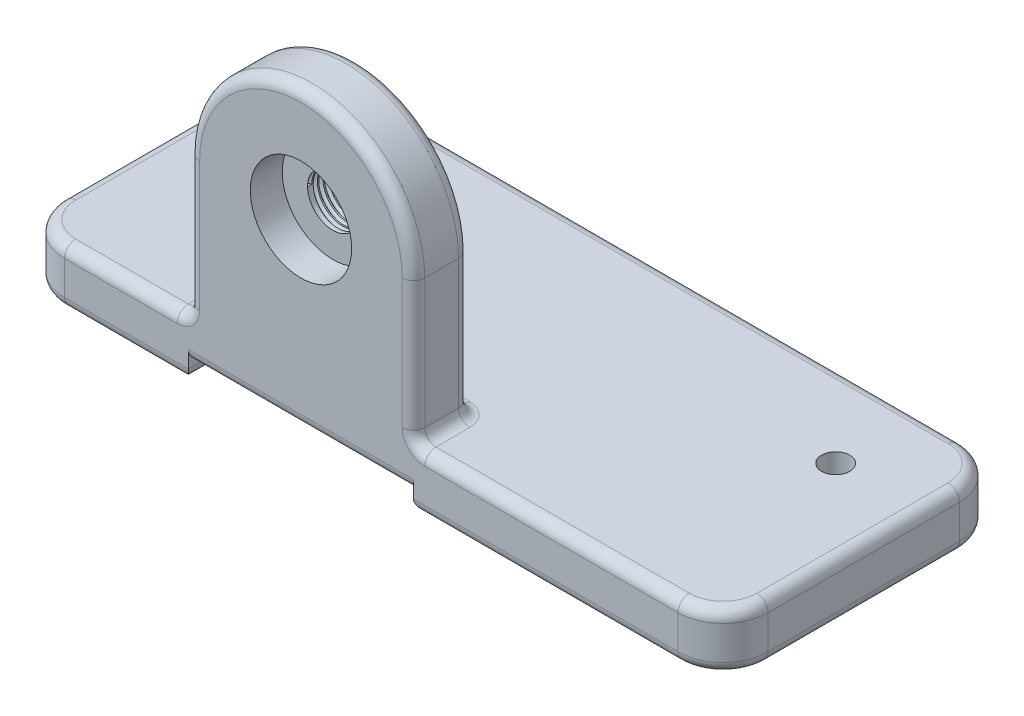
from build123d import *

# Parameters (mm, degrees)
SKETCH2_W                               = 125
SKETCH2_H                               = 50
BOSS_EXTRUDE1_DEPTH                     = 10
BOSS_EXTRUDE2_DEPTH                     = 10
SKETCH5_W                               = 40
SKETCH5_H                               = 3
CUT_EXTRUDE1_DEPTH                      = 146.430395722
CBORE_FOR_M8_HEX_HEAD_BOLT1_D           = 9
CBORE_FOR_M8_HEX_HEAD_BOLT1_CBORE_D     = 18.01
CBORE_FOR_M8_HEX_HEAD_BOLT1_CBORE_DEPTH = 5.68
THREAD1_PITCH                           = 1
F_5_0MM_DOWEL_HOLE2_D                   = 5
F_5_0MM_DOWEL_HOLE2_DEPTH               = 5
F_5_0MM_DOWEL_HOLE2_TIP                 = 1.502151548
FILLET2_R                               = 2
FILLET3_R                               = 8


with BuildPart() as part:
    # Sketch2 → Boss-Extrude1 (new body)
    with BuildSketch(Plane(origin=(0, 0, 0), x_dir=(1, 0, 0), z_dir=(0, 1, 0))):
        with Locations((62.5, 25)):
            Rectangle(SKETCH2_W, SKETCH2_H)
    extrude(amount=BOSS_EXTRUDE1_DEPTH)

    # Sketch4 → Boss-Extrude2 (add)
    with BuildSketch(Plane.XY):
        with BuildLine():
            Line((30, 0), (30, 35))
            ThreePointArc((30, 35), (50, 55), (70, 35))
            Line((70, 35), (70, 0))
            Line((70, 0), (30, 0))
        make_face()
    extrude(amount=-BOSS_EXTRUDE2_DEPTH)

    # Sketch5 → Cut-Extrude1 (cut, through all)
    with BuildSketch(Plane.XY):
        with Locations((50, 1.5)):
            Rectangle(SKETCH5_W, SKETCH5_H)
    extrude(amount=-CUT_EXTRUDE1_DEPTH, mode=Mode.SUBTRACT)

    # CBORE for M8 Hex Head Bolt1 (through all)
    with Locations(Plane.XY):
        with Locations((50, 35)):
            CounterBoreHole(CBORE_FOR_M8_HEX_HEAD_BOLT1_D / 2, CBORE_FOR_M8_HEX_HEAD_BOLT1_CBORE_D / 2, CBORE_FOR_M8_HEX_HEAD_BOLT1_CBORE_DEPTH)

    # Thread1: the profile of Thread Profile2 profile screwed along a right-hand helix of 10 turns, 8 arcs to a turn; built about Z, then put on its axis
    thread1_z = Axis((0, 0, 0), (0, 0, 1))
    thread1_corners = [(4.4997, 0, -0.000173205), (5.041265875, 0, 0.312499999), (5.041265875, 0, 0.437499999), (4.4997, 0, 0.750173202)]
    with BuildLine(mode=Mode.PRIVATE) as thread1_profile:
        Line(thread1_corners[0], thread1_corners[1])
        Line(thread1_corners[1], thread1_corners[2])
        Line(thread1_corners[2], thread1_corners[3])
        Line(thread1_corners[3], thread1_corners[0])
    thread1_cap = Face(thread1_profile.wire())
    thread1_turn_angles = [0, 22.5, 45, 67.5, 90, 112.5, 135, 157.5, 180, 202.5, 225, 247.5, 270, 292.5, 315, 337.5, 360]
    thread1_turn_weights = [1, 0.9238795325112867, 1, 0.9238795325112867, 1, 0.9238795325112867, 1, 0.9238795325112867, 1, 0.9238795325112867, 1, 0.9238795325112867, 1, 0.9238795325112867, 1, 0.9238795325112867, 1]
    thread1_turn_rails = [Edge.make_bspline([Vector(p[0], p[1], 0).rotate(thread1_z, thread1_turn_angles[k]) / thread1_turn_weights[k] + Vector(0, 0, p[2] + THREAD1_PITCH * thread1_turn_angles[k] / 360) for k in range(17)], [0, 0, 0, 1, 1, 2, 2, 3, 3, 4, 4, 5, 5, 6, 6, 7, 7, 8, 8, 8], 2, thread1_turn_weights) for p in thread1_corners]
    thread1_turn_sides = [Face.make_surface_from_curves(thread1_turn_rails[p[0]], thread1_turn_rails[p[1]]) for p in [(0, 1), (1, 2), (2, 3), (3, 0)]]
    thread1 = Plane(origin=(50, 35, -5.68), x_dir=(-1, 0, 0), z_dir=(0, 0, -1)) * Solid(Shell([*[p.moved(Location((0, 0, THREAD1_PITCH * i))) for i in range(10) for p in thread1_turn_sides], thread1_cap, thread1_cap.rotate(thread1_z, 3600).moved(Location((0, 0, THREAD1_PITCH * 3600 / 360)))]))
    add(thread1, mode=Mode.SUBTRACT)

    # Ø5.0mm Dowel Hole2
    with Locations(Plane(origin=(0, 10, 0), x_dir=(1, 0, 0), z_dir=(0, 1, 0))):
        with Locations((15, 35), (110, 35)):
            Hole(F_5_0MM_DOWEL_HOLE2_D / 2, depth=F_5_0MM_DOWEL_HOLE2_DEPTH)
            with Locations((0, 0, -(F_5_0MM_DOWEL_HOLE2_DEPTH + F_5_0MM_DOWEL_HOLE2_TIP / 2))):  # 118° drill point
                Cone(0, F_5_0MM_DOWEL_HOLE2_D / 2, F_5_0MM_DOWEL_HOLE2_TIP, mode=Mode.SUBTRACT)

    # Fillet2
    fillet2_edges = [part.edges().sort_by_distance(p)[0] for p in [
        (125, 10, -25),
        (97.5, 10, 0),
        (62.5, 10, -50),
        (30, 10, -5),
        (70, 10, -5),
        (30, 22.5, -10),
        (50, 55, -10),
        (70, 22.5, -10),
        (50, 55, 0),
        (50, 10, -10),
        (97.5, 0, 0),
        (15, 0, -50),
        (30, 0, -25),
        (50, 3, -50),
        (70, 0, -25),
        (50, 3, 0),
        (0, 10, -25),
        (97.5, 0, -50),
        (125, 0, -25),
        (15, 0, 0),
        (0, 0, -25),
        (15, 10, 0),
    ]]
    fillet(fillet2_edges, radius=FILLET2_R)

    # Fillet3
    # the kernel refuses this fillet: 8 mm, written as the material it takes off along each edge
    with BuildSketch(Plane(origin=(8, 10, -42), x_dir=(0, 0, -1), z_dir=(1, 0, 0))) as fillet3_piece_1:
        with BuildLine():
            CenterArc((6, -2), 2, 0, 90)
            Line((8, -2), (8, 0))
            Line((8, 0), (6, 0))
        make_face()
    revolve(axis=Axis((8, 10, -42), (0, 1, 0)), revolution_arc=90, mode=Mode.SUBTRACT)
    with BuildSketch(Plane(origin=(117, 10, -42), x_dir=(1, 0, 0), z_dir=(0, 0, 1))) as fillet3_piece_2:
        with BuildLine():
            CenterArc((6, -2), 2, 0, 90)
            Line((8, -2), (8, 0))
            Line((8, 0), (6, 0))
        make_face()
    revolve(axis=Axis((117, 10, -42), (0, 1, 0)), revolution_arc=90, mode=Mode.SUBTRACT)
    with BuildSketch(Plane(origin=(8, 10, -8), x_dir=(-1, 0, 0), z_dir=(0, 0, -1))) as fillet3_piece_3:
        with BuildLine():
            CenterArc((6, -2), 2, 0, 90)
            Line((8, -2), (8, 0))
            Line((8, 0), (6, 0))
        make_face()
    revolve(axis=Axis((8, 10, -8), (0, 1, 0)), revolution_arc=90, mode=Mode.SUBTRACT)
    with BuildSketch(Plane(origin=(117, 10, -8), x_dir=(0, 0, 1), z_dir=(-1, 0, 0))) as fillet3_piece_4:
        with BuildLine():
            CenterArc((6, -2), 2, 0, 90)
            Line((8, -2), (8, 0))
            Line((8, 0), (6, 0))
        make_face()
    revolve(axis=Axis((117, 10, -8), (0, 1, 0)), revolution_arc=90, mode=Mode.SUBTRACT)
    with BuildSketch(Plane(origin=(8, 0, -8), x_dir=(0, 0, 1), z_dir=(1, 0, 0))) as fillet3_piece_5:
        with BuildLine():
            CenterArc((6, -2), 2, 0, 90)
            Line((8, -2), (8, 0))
            Line((8, 0), (6, 0))
        make_face()
    revolve(axis=Axis((8, 0, -8), (0, -1, 0)), revolution_arc=90, mode=Mode.SUBTRACT)
    with BuildSketch(Plane(origin=(8, 0, -42), x_dir=(-1, 0, 0), z_dir=(0, 0, 1))) as fillet3_piece_6:
        with BuildLine():
            CenterArc((6, -2), 2, 0, 90)
            Line((8, -2), (8, 0))
            Line((8, 0), (6, 0))
        make_face()
    revolve(axis=Axis((8, 0, -42), (0, -1, 0)), revolution_arc=90, mode=Mode.SUBTRACT)
    with BuildSketch(Plane(origin=(117, 0, -42), x_dir=(0, 0, -1), z_dir=(-1, 0, 0))) as fillet3_piece_7:
        with BuildLine():
            CenterArc((6, -2), 2, 0, 90)
            Line((8, -2), (8, 0))
            Line((8, 0), (6, 0))
        make_face()
    revolve(axis=Axis((117, 0, -42), (0, -1, 0)), revolution_arc=90, mode=Mode.SUBTRACT)
    with BuildSketch(Plane(origin=(117, 0, -8), x_dir=(1, 0, 0), z_dir=(0, 0, -1))) as fillet3_piece_8:
        with BuildLine():
            CenterArc((6, -2), 2, 0, 90)
            Line((8, -2), (8, 0))
            Line((8, 0), (6, 0))
        make_face()
    revolve(axis=Axis((117, 0, -8), (0, -1, 0)), revolution_arc=90, mode=Mode.SUBTRACT)
    with BuildSketch(Plane(origin=(0, 0, -50), x_dir=(1, 0, 0), z_dir=(0, 1, 0)), Plane(origin=(125, 0, 0), x_dir=(-1, 0, 0), z_dir=(0, 1, 0))) as fillet3_piece_9:
        with BuildLine():
            CenterArc((FILLET3_R, -FILLET3_R), FILLET3_R, 90, 90)
            Line((0, -FILLET3_R), (0, 0))
            Line((0, 0), (FILLET3_R, 0))
        make_face()
    extrude(amount=10, mode=Mode.SUBTRACT)
    with BuildSketch(Plane(origin=(125, 0, -50), x_dir=(-1, 0, 0), z_dir=(0, 1, 0)), Plane(origin=(0, 0, 0), x_dir=(1, 0, 0), z_dir=(0, 1, 0))) as fillet3_piece_10:
        with BuildLine():
            CenterArc((FILLET3_R, FILLET3_R), FILLET3_R, 180, 90)
            Line((0, FILLET3_R), (0, 0))
            Line((0, 0), (FILLET3_R, 0))
        make_face()
    extrude(amount=10, mode=Mode.SUBTRACT)


solid = part.part
